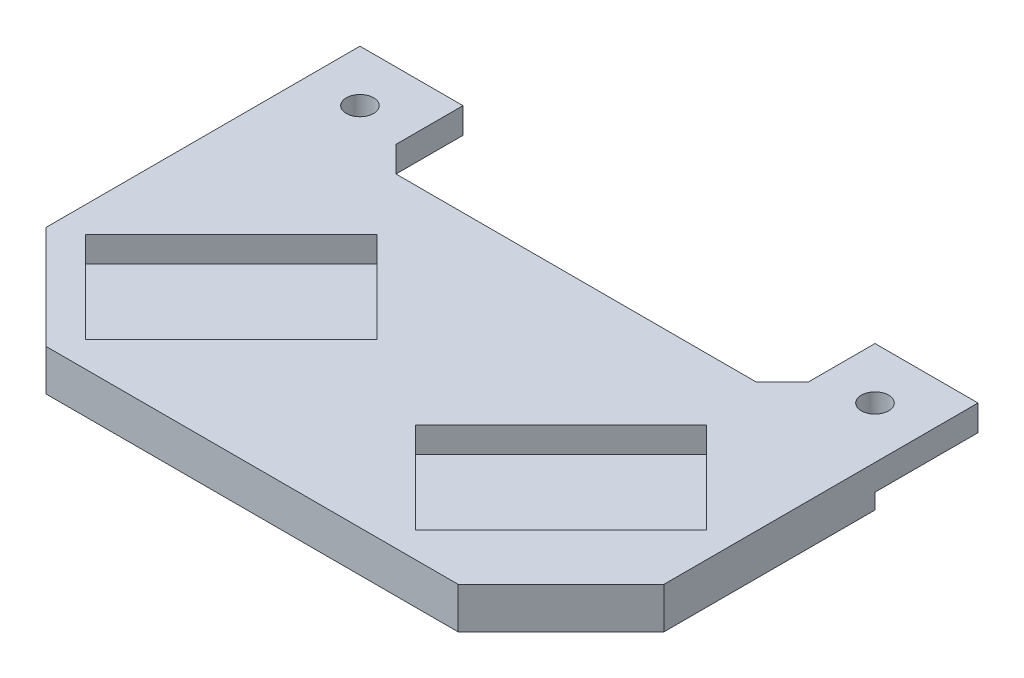
from build123d import *

# Parameters (mm, degrees)
SKETCH1_W           = 120
SKETCH1_H           = 80.961940777
SKETCH1_R           = 2.65
BOSS_EXTRUDE1_DEPTH = 5
SKETCH2_W           = 120
SKETCH2_H           = 60.961940777
BOSS_EXTRUDE2_DEPTH = 3
SKETCH3_W           = 80
SKETCH3_H           = 18
CUT_EXTRUDE1_DEPTH  = 5
CHAMFER1_SIZE       = 5
CHAMFER2_SIZE       = 20


with BuildPart() as part:
    # Sketch1 → Boss-Extrude1 (new body)
    with BuildSketch(Plane(origin=(0, 0, 0), x_dir=(1, 0, 0), z_dir=(0, 1, 0))):
        with Locations((60, -20.480970389)):
            Rectangle(SKETCH1_W, SKETCH1_H)
        with Locations((10, 10)):
            Circle(SKETCH1_R, mode=Mode.SUBTRACT)
        with Locations((110, 10)):
            Circle(SKETCH1_R, mode=Mode.SUBTRACT)
        Polygon((69.038059223, -38.284271247), (97.32233047, -10), (115, -27.67766953), (86.715728753, -55.961940777), align=None, mode=Mode.SUBTRACT)
        Polygon((22.67766953, -55.961940777), (5, -38.284271247), (33.284271247, -10), (50.961940777, -27.67766953), align=None, mode=Mode.SUBTRACT)
    extrude(amount=BOSS_EXTRUDE1_DEPTH)

    # Sketch2 → Boss-Extrude2 (add)
    with BuildSketch(Plane.XZ):
        with Locations((60, 30.480970389)):
            Rectangle(SKETCH2_W, SKETCH2_H)
    extrude(amount=BOSS_EXTRUDE2_DEPTH)

    # Sketch3 → Cut-Extrude1 (cut)
    with BuildSketch(Plane(origin=(0, 5, 0), x_dir=(1, 0, 0), z_dir=(0, 1, 0))):
        with Locations((60, 11)):
            Rectangle(SKETCH3_W, SKETCH3_H)
    extrude(amount=-CUT_EXTRUDE1_DEPTH, mode=Mode.SUBTRACT)

    # Chamfer1
    chamfer1_edges = [part.edges().sort_by_distance(p)[0] for p in [
        (20, 2.5, -2),
        (100, 2.5, -2),
    ]]
    chamfer(chamfer1_edges, length=CHAMFER1_SIZE)

    # Chamfer2
    chamfer2_edges = [part.edges().sort_by_distance(p)[0] for p in [
        (120, 1, 60.961940777),
        (0, 1, 60.961940777),
    ]]
    chamfer(chamfer2_edges, length=CHAMFER2_SIZE)


solid = part.part
